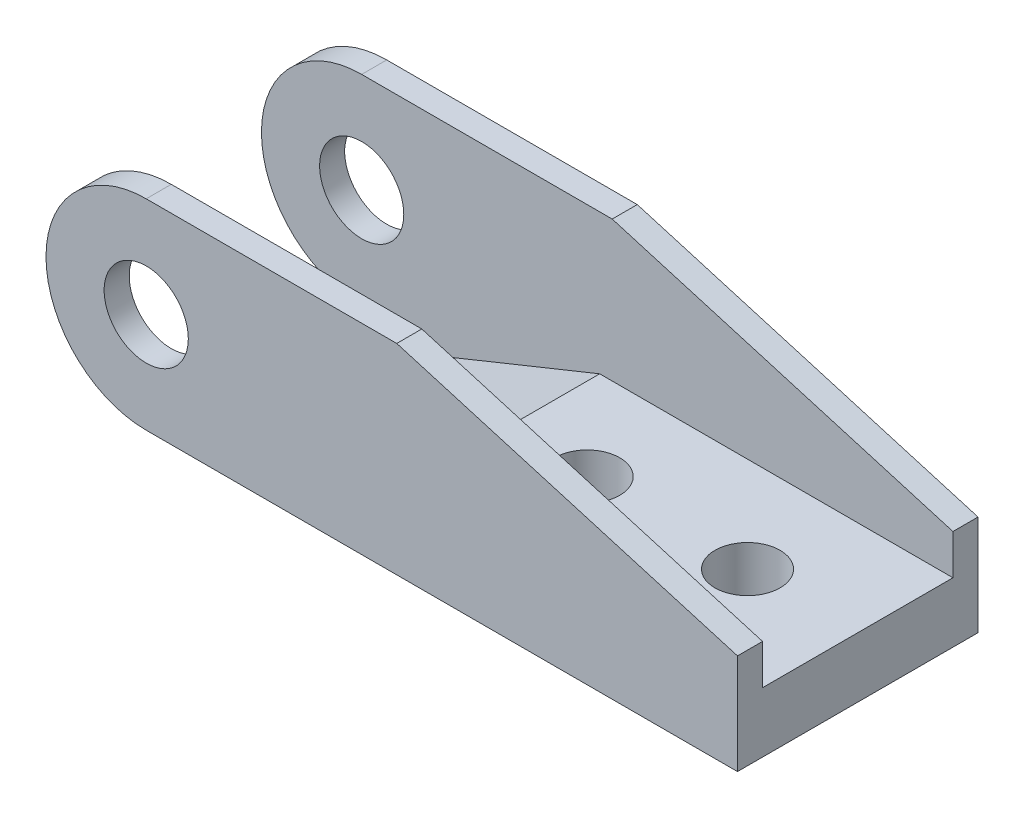
from build123d import *

# Parameters (mm, degrees)
CROQUIS1_W              = 34.5
CROQUIS1_H              = 12
SALIENTE_EXTRUIR1_DEPTH = 10
REDONDEO1_R             = 5
CROQUIS8_W              = 34.5
CROQUIS8_H              = 9.5
CORTAR_EXTRUIR6_DEPTH   = 7
CROQUIS9_W              = 10.737065785
CROQUIS9_H              = 9.5
CORTAR_EXTRUIR7_DEPTH   = 21.822163672
CHAFL_N1_SIZE           = 3
CHAFL_N1_SIZE_2         = 7.42526056
CORTAR_EXTRUIR8_DEPTH   = 24.27149544
CROQUIS11_R             = 2.1
CORTAR_EXTRUIR9_DEPTH   = 24.27149544
CROQUIS12_R             = 1.625
CORTAR_EXTRUIR10_DEPTH  = 20.559204994


# Some blends are built 0.0001 mm under size
with BuildPart() as part:
    # Croquis1 → Saliente-Extruir1 (new body)
    with BuildSketch(Plane(origin=(0, 0, 0), x_dir=(1, 0, 0), z_dir=(0, 1, 0))):
        Rectangle(CROQUIS1_W, CROQUIS1_H)
    extrude(amount=SALIENTE_EXTRUIR1_DEPTH)

    # Redondeo1
    redondeo1_edges = [part.edges().sort_by_distance(p)[0] for p in [
        (-17.25, 10, 0),
        (-17.25, 0, 0),
    ]]
    fillet(redondeo1_edges, radius=REDONDEO1_R - 0.0001)  # a hair under: the kernel refuses the full size

    # Croquis8 → Cortar-Extruir6 (cut)
    with BuildSketch(Plane(origin=(0, 10, 0), x_dir=(1, 0, 0), z_dir=(0, 1, 0))):
        Rectangle(CROQUIS8_W, CROQUIS8_H)
    extrude(amount=-CORTAR_EXTRUIR6_DEPTH, mode=Mode.SUBTRACT)

    # Croquis9 → Cortar-Extruir7 (cut, through all)
    with BuildSketch(Plane.XZ):
        with Locations((-13.168532893, 0)):
            Rectangle(CROQUIS9_W, CROQUIS9_H)
    extrude(amount=-CORTAR_EXTRUIR7_DEPTH, mode=Mode.SUBTRACT)

    # Chaflán1
    # the kernel refuses this chamfer: 7.42526056, 3 mm, written as the material it takes off along each edge
    with BuildSketch(Plane(origin=(-7.8, 3, -4.75), x_dir=(-0.08816706473193606, -0.9961057015681392, 0), z_dir=(0, 0, 1))) as chafl_n1_piece_1:
        Polygon((CHAFL_N1_SIZE * 0.996105701568, CHAFL_N1_SIZE * 0.0881670647319), (-CHAFL_N1_SIZE_2 * 0.0881670647349, CHAFL_N1_SIZE_2 * 0.996105701602), (0, 0), align=None)
    extrude(amount=9.5, mode=Mode.SUBTRACT)

    # Croquis10 → Cortar-Extruir8 (cut, through all)
    with BuildSketch(Plane.XY.offset(6)):
        Polygon((0.25, 10), (17.25, 5), (17.25, 10), align=None)
    extrude(amount=-CORTAR_EXTRUIR8_DEPTH, mode=Mode.SUBTRACT)

    # Croquis11 → Cortar-Extruir9 (cut, through all)
    with BuildSketch(Plane.XY.offset(6)):
        with Locations((-12.25, 5)):
            Circle(CROQUIS11_R)
    extrude(amount=-CORTAR_EXTRUIR9_DEPTH, mode=Mode.SUBTRACT)

    # Croquis12 → Cortar-Extruir10 (cut, through all)
    with BuildSketch(Plane(origin=(0, 3, 0), x_dir=(1, 0, 0), z_dir=(0, 1, 0))):
        with Locations(Location((3.75, 0, 0), (0, 0, 270))):
            Circle(CROQUIS12_R)
        with Locations(Location((11.75, 0, 0), (0, 0, 270))):
            Circle(CROQUIS12_R)
    extrude(amount=-CORTAR_EXTRUIR10_DEPTH, mode=Mode.SUBTRACT)


solid = part.part
